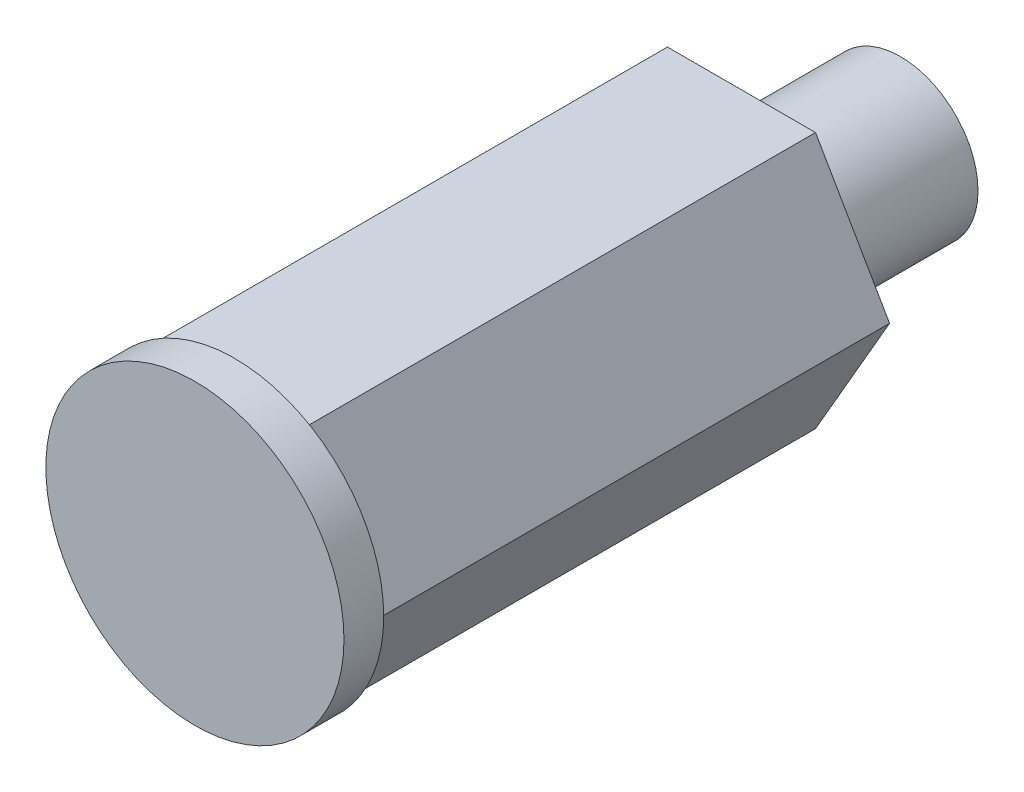
from build123d import *

# Parameters (mm, degrees)
SKETCH1_R           = 3.9
BOSS_EXTRUDE1_DEPTH = 8
BOSS_EXTRUDE2_DEPTH = 25.5
SKETCH3_R           = 7.5
BOSS_EXTRUDE3_DEPTH = 2


with BuildPart() as part:
    # Sketch1 → Boss-Extrude1 (new body)
    with BuildSketch(Plane.XY):
        Circle(SKETCH1_R)
        with BuildLine():
            Line((-1.944164345, -2.015), (-1.944164345, 2.015))
            ThreePointArc((-1.944164345, 2.015), (0, 2.8), (1.944164345, 2.015))
            Line((1.944164345, 2.015), (1.944164345, -2.015))
            ThreePointArc((1.944164345, -2.015), (0, -2.8), (-1.944164345, -2.015))
        make_face(mode=Mode.SUBTRACT)
    extrude(amount=BOSS_EXTRUDE1_DEPTH)

    # Sketch2 → Boss-Extrude2 (add)
    with BuildSketch(Plane.XY.offset(8)):
        Polygon((3.725, 6.451889258), (-3.725, 6.451889258), (-7.45, 0), (-3.725, -6.451889258), (3.725, -6.451889258), (7.45, 0), align=None)
    extrude(amount=BOSS_EXTRUDE2_DEPTH)

    # Sketch3 → Boss-Extrude3 (add)
    with BuildSketch(Plane.XY.offset(33.5)):
        Circle(SKETCH3_R)
    extrude(amount=BOSS_EXTRUDE3_DEPTH)


solid = part.part
